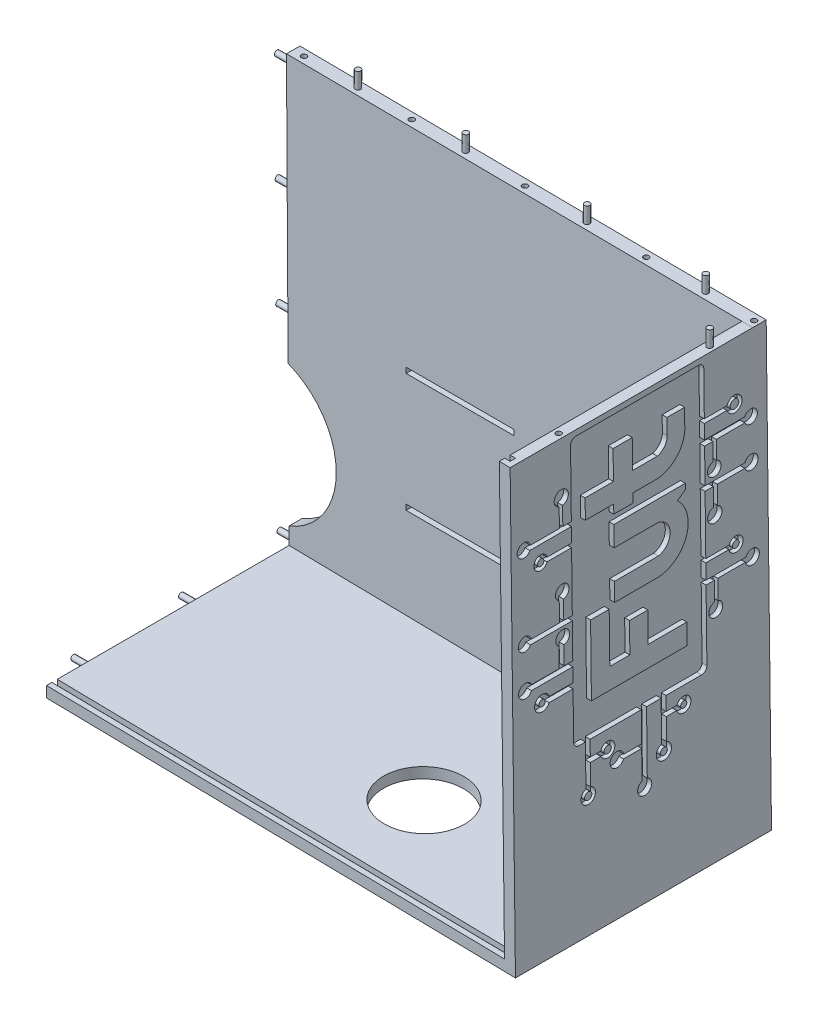
from build123d import *

# Parameters (mm, degrees)
SALIENTE_EXTRUIR1_DEPTH   = 2.5
SALIENTE_EXTRUIR2_DEPTH   = 45
CROQUIS17_R               = 1.5
CROQUIS17_R_2             = 2
CROQUIS17_W               = 20
CROQUIS17_H               = 1
CORTAR_EXTRUIR1_DEPTH     = 45
CORTAR_EXTRUIR2_REACH     = 131.472
CROQUIS18_W               = 1.000217957
CROQUIS18_H               = 1
CROQUIS19_W               = 1
CROQUIS19_H               = 79.48231635
CORTAR_EXTRUIR3_DEPTH     = 1
CROQUIS27_W               = 1
CROQUIS27_H               = 1
CORTAR_EXTRUIR7_DEPTH     = 1
CORTAR_EXTRUIR8_START     = -1
CORTAR_EXTRUIR8_OUTLINE_W = 85.327046857
CORTAR_EXTRUIR8_OUTLINE_H = 1
CORTAR_EXTRUIR8_DEPTH     = 1
CORTAR_EXTRUIR9_START     = 45.5
CORTAR_EXTRUIR9_DEPTH     = 0.999774645
CROQUIS30_R               = 0.5
CORTAR_EXTRUIR10_DEPTH    = 4
CROQUIS32_R               = 0.5
SALIENTE_EXTRUIR3_DEPTH   = 3
CROQUIS33_R               = 0.5
CORTAR_EXTRUIR14_DEPTH    = 4
CROQUIS34_R               = 0.5
SALIENTE_EXTRUIR4_DEPTH   = 3
CROQUIS35_R               = 0.5
SALIENTE_EXTRUIR5_DEPTH   = 3
CROQUIS36_R               = 0.5
CORTAR_EXTRUIR15_DEPTH    = 4
CROQUIS37_R               = 0.5
CORTAR_EXTRUIR16_DEPTH    = 4
CROQUIS38_R               = 0.5
SALIENTE_EXTRUIR6_DEPTH   = 3
CROQUIS39_R               = 7.5
CORTAR_EXTRUIR17_DEPTH    = 45
CROQUIS40_R               = 0.809361407
CROQUIS40_R_2             = 0.629854235
CROQUIS40_R_3             = 0.570829354
CROQUIS40_R_4             = 0.638132934
CROQUIS40_R_5             = 0.670441591
CROQUIS40_R_6             = 0.67413745
CROQUIS40_R_7             = 0.574661976
CROQUIS40_R_8             = 0.600575541
CORTAR_EXTRUIR18_DEPTH    = 0.9


# Read off the part's stored shape, not the designer's step: Cortar-Extruir8, Cortar-Extruir9
with BuildPart() as part:
    # Croquis15 → Saliente-Extruir1 (new body)
    with BuildSketch(Plane.XY):
        Polygon((0.493585448, -0.747010607), (86.987170897, -1.494021214), (87.974341793, -82.988042428), (0.987170897, -81.494021214), align=None)
    extrude(amount=SALIENTE_EXTRUIR1_DEPTH)

    # Croquis16 → Saliente-Extruir2 (add)
    with BuildSketch(Plane.XY.offset(2.5)):
        Polygon((0.974771701, -79.49351329), (0.987170897, -81.494021214), (87.974341793, -82.988042428), (86.987170897, -1.494021214), (84.986811751, -1.476485582), (85.949543401, -80.952971165), align=None)
    extrude(amount=SALIENTE_EXTRUIR2_DEPTH)

    # Croquis17 → Cortar-Extruir1 (cut)
    with BuildSketch(Plane.XY.offset(2.5)):
        with Locations((72.120400503, -26)):
            Circle(CROQUIS17_R)
        with Locations((80.899665143, -76.865648614)):
            Circle(CROQUIS17_R_2)
        with BuildLine():
            Line((0.955966786, -76.389254287), (0.796795552, -50.349991207))
            ThreePointArc((0.796795552, -50.349991207), (9.730065674, -63.315502479), (0.955966786, -76.389254287))
        make_face()
        with Locations((32.694186133, -62.5)):
            Rectangle(CROQUIS17_W, CROQUIS17_H)
        with Locations((62.694186133, -62.5)):
            Rectangle(CROQUIS17_W, CROQUIS17_H)
        with Locations((32.694186133, -40.5)):
            Rectangle(CROQUIS17_W, CROQUIS17_H)
        with Locations((62.694186133, -40.5)):
            Rectangle(CROQUIS17_W, CROQUIS17_H)
    extrude(amount=-CORTAR_EXTRUIR1_DEPTH, mode=Mode.SUBTRACT)

    # Cortar-Extruir2: up to this face of the body (flat: up to its plane)
    cortar_extruir2_end = Plane(part.part.faces().sort_by_distance((43.462157551, -80.223242227, 25))[0])
    # Croquis18 → Cortar-Extruir2 (cut, up to the picked face)
    with BuildSketch(Plane(origin=(-0.006411756, -0.731414451, 0), x_dir=(0.9999615787185102, -0.008765904789859459, 0), z_dir=(0.008765904789859457, 0.9999615787185101, 0)), mode=Mode.PRIVATE) as cortar_extruir2_sk1:
        with Locations((85.49659828, -46)):
            Rectangle(CROQUIS18_W, CROQUIS18_H)
    cortar_extruir2_tool1 = split(extrude(cortar_extruir2_sk1.sketch, amount=-CORTAR_EXTRUIR2_REACH, mode=Mode.PRIVATE), bisect_by=cortar_extruir2_end, keep=Keep.BOTH, mode=Mode.PRIVATE)
    add(cortar_extruir2_tool1.solids().sort_by(Axis((85.486902, -1.480869, 46), (-0.008765904789859457, -0.9999615787185101, 0)))[0], mode=Mode.SUBTRACT)

    # Croquis19 → Cortar-Extruir3 (cut)
    with BuildSketch(Plane(origin=(84.956460397, 1.029112859, 0), x_dir=(0, 0, 1), z_dir=(-0.9999266406620362, -0.012112526339916574, 0))):
        with Locations((46, -42.246940442)):
            Rectangle(CROQUIS19_W, CROQUIS19_H)
    extrude(amount=-CORTAR_EXTRUIR3_DEPTH, mode=Mode.SUBTRACT)

    # Croquis27 → Cortar-Extruir7 (cut)
    with BuildSketch(Plane(origin=(0.993083004, -81.982084024, 0), x_dir=(0.9999266406620362, 0.012112526339916574, 0), z_dir=(-0.012112526339916574, 0.9999266406620362, 0))):
        with Locations((85.462693204, -46)):
            Rectangle(CROQUIS27_W, CROQUIS27_H)
    extrude(amount=-CORTAR_EXTRUIR7_DEPTH, mode=Mode.SUBTRACT)

    # Cortar-Extruir8 outline → Cortar-Extruir8 (cut)
    with BuildSketch(Plane(origin=(-1.364626126, -79.453333687, 0), x_dir=(0.9998525390425657, -0.01717265763167723, 0), z_dir=(0.01717265763167723, 0.9998525390425657, 0)).offset(CORTAR_EXTRUIR8_START)):
        with Locations((44.663523428, -46)):
            Rectangle(CORTAR_EXTRUIR8_OUTLINE_W, CORTAR_EXTRUIR8_OUTLINE_H)
    extrude(amount=CORTAR_EXTRUIR8_DEPTH, mode=Mode.SUBTRACT)

    # Cortar-Extruir9 outline → Cortar-Extruir9 (cut)
    with BuildSketch(Plane.XY.offset(CORTAR_EXTRUIR9_START)):
        Polygon((85.961655928, -81.952897805), (85.949543401, -80.952971165), (85.932370744, -81.952823704), (86.961942597, -81.970506796), (86.961582568, -81.940785279), align=None)
    extrude(amount=CORTAR_EXTRUIR9_DEPTH, mode=Mode.SUBTRACT)

    # Croquis30 → Cortar-Extruir10 (cut)
    with BuildSketch(Plane(origin=(-0.006411756, -0.731414451, 0), x_dir=(0.9999615787185102, -0.008765904789859459, 0), z_dir=(0.008765904789859457, 0.9999615787185101, 0))):
        with Locations(Location((85.996707183, -37.5, 0), (0, 0, 180))):
            Circle(CROQUIS30_R)
    extrude(amount=-CORTAR_EXTRUIR10_DEPTH, mode=Mode.SUBTRACT)

    # Croquis32 → Saliente-Extruir3 (add)
    with BuildSketch(Plane(origin=(-0.006414337, -0.742692308, 0), x_dir=(0.9999627066458414, -0.008636279148040221, 0), z_dir=(0.008636279148040221, 0.9999627066458414, 0))):
        with Locations((12.500018433, -1.25)):
            Circle(CROQUIS32_R)
        with Locations((32.500018433, -1.25)):
            Circle(CROQUIS32_R)
        with Locations((55.000018433, -1.25)):
            Circle(CROQUIS32_R)
        with Locations((77.000018433, -1.25)):
            Circle(CROQUIS32_R)
    extrude(amount=SALIENTE_EXTRUIR3_DEPTH)

    # Croquis33 → Cortar-Extruir14 (cut)
    with BuildSketch(Plane(origin=(-0.006414337, -0.742692308, 0), x_dir=(0.9999627066458414, -0.008636279148040221, 0), z_dir=(0.008636279148040221, 0.9999627066458414, 0))):
        with Locations(Location((85.996829638, -1.25, 0), (0, 0, 180))):
            Circle(CROQUIS33_R)
        with Locations(Location((2.500018433, -1.25, 0), (0, 0, 180))):
            Circle(CROQUIS33_R)
        with Locations(Location((22.500018433, -1.25, 0), (0, 0, 180))):
            Circle(CROQUIS33_R)
        with Locations(Location((43.496829638, -1.25, 0), (0, 0, 180))):
            Circle(CROQUIS33_R)
        with Locations(Location((65.996829638, -1.25, 0), (0, 0, 180))):
            Circle(CROQUIS33_R)
    extrude(amount=-CORTAR_EXTRUIR14_DEPTH, mode=Mode.SUBTRACT)

    # Croquis34 → Saliente-Extruir4 (add)
    with BuildSketch(Plane(origin=(-0.006411756, -0.731414451, 0), x_dir=(0.9999615787185102, -0.008765904789859459, 0), z_dir=(0.008765904789859457, 0.9999615787185101, 0))):
        with Locations((85.996707183, -9.5)):
            Circle(CROQUIS34_R)
    extrude(amount=SALIENTE_EXTRUIR4_DEPTH)

    # Croquis35 → Saliente-Extruir5 (add)
    with BuildSketch(Plane(origin=(0.489000895, 0.002989135, 0), x_dir=(0, 0, 1), z_dir=(-0.9999813177309185, -0.006112625388175005, 0))):
        with Locations(Location((1.25, -79.193670629, 0), (0, 0, 90))):
            Circle(CROQUIS35_R)
        with Locations(Location((1.25, -2.750013754, 0), (0, 0, 90))):
            Circle(CROQUIS35_R)
        with Locations(Location((1.25, -22.750013754, 0), (0, 0, 90))):
            Circle(CROQUIS35_R)
        with Locations(Location((1.25, -42.750013754, 0), (0, 0, 90))):
            Circle(CROQUIS35_R)
    extrude(amount=SALIENTE_EXTRUIR5_DEPTH)

    # Croquis36 → Cortar-Extruir15 (cut)
    with BuildSketch(Plane(origin=(0.489000895, 0.002989135, 0), x_dir=(0, 0, 1), z_dir=(-0.9999813177309185, -0.006112625388175005, 0))):
        with Locations(Location((1.25, -12.750013754, 0), (0, 0, 270))):
            Circle(CROQUIS36_R)
        with Locations(Location((1.25, -32.750013754, 0), (0, 0, 270))):
            Circle(CROQUIS36_R)
    extrude(amount=-CORTAR_EXTRUIR15_DEPTH, mode=Mode.SUBTRACT)

    # Croquis37 → Cortar-Extruir16 (cut)
    with BuildSketch(Plane(origin=(0.482050481, 0.00298776, 0), x_dir=(0, 0, 1), z_dir=(-0.9999807928027947, -0.006197904927802061, 0))):
        with Locations(Location((9.5, -80.498301159, 0), (0, 0, 270))):
            Circle(CROQUIS37_R)
        with Locations(Location((29.5, -80.498301159, 0), (0, 0, 270))):
            Circle(CROQUIS37_R)
    extrude(amount=-CORTAR_EXTRUIR16_DEPTH, mode=Mode.SUBTRACT)

    # Croquis38 → Saliente-Extruir6 (add)
    with BuildSketch(Plane(origin=(0.482050481, 0.00298776, 0), x_dir=(0, 0, 1), z_dir=(-0.9999807928027947, -0.006197904927802061, 0))):
        with Locations(Location((19.5, -80.498301159, 0), (0, 0, 90))):
            Circle(CROQUIS38_R)
        with Locations(Location((39.5, -80.498301159, 0), (0, 0, 90))):
            Circle(CROQUIS38_R)
    extrude(amount=SALIENTE_EXTRUIR6_DEPTH)

    # Croquis39 → Cortar-Extruir17 (cut)
    with BuildSketch(Plane(origin=(-1.398971441, -81.453038765, 0), x_dir=(0.9998525390425657, -0.017172657631677572, 0), z_dir=(-0.017172657631677572, -0.9998525390425657, 0))):
        with Locations((54.886494253, 30)):
            Circle(CROQUIS39_R)
    extrude(amount=-CORTAR_EXTRUIR17_DEPTH, mode=Mode.SUBTRACT)

    # Croquis40 → Cortar-Extruir18 (cut)
    with BuildSketch(Plane(origin=(86.956313679, 1.053337912, 0), x_dir=(0, 0, -1), z_dir=(0.9999266406620362, 0.012112526339916486, 0))):
        with BuildLine():
            Line((-35.321453593, -52.987764763), (-34.142461856, -52.987764763))
            Line((-34.142461856, -52.987764763), (-34.142461856, -60.542839641))
            ThreePointArc((-34.142461856, -60.542839641), (-33.754916637, -63.170516444), (-33.276623684, -60.557833431))
            Line((-33.276623684, -60.557833431), (-33.276623684, -56.702399451))
            Line((-33.276623684, -56.702399451), (-31.334219947, -56.702399451))
            Line((-31.334219947, -56.702399451), (-31.334219947, -56.632292597))
            ThreePointArc((-31.334219947, -56.632292597), (-28.717421131, -56.230691353), (-31.334219947, -55.829090109))
            Line((-31.334219947, -55.829090109), (-33.276623684, -55.829090109))
            Line((-33.276623684, -55.829090109), (-33.276623684, -52.987764763))
            Line((-33.276623684, -52.987764763), (-23.78409883, -52.987764763))
            Line((-23.78409883, -52.987764763), (-23.78409883, -58.451870369))
            Line((-23.78409883, -58.451870369), (-27.078464782, -58.451870369))
            ThreePointArc((-27.078464782, -58.451870369), (-29.642810051, -58.571842219), (-27.147404615, -59.174512621))
            Line((-27.147404615, -59.174512621), (-23.78409883, -59.174512621))
            Line((-23.78409883, -59.174512621), (-23.78409883, -64.379197107))
            ThreePointArc((-23.78409883, -64.379197107), (-23.307020575, -66.916868312), (-22.806237845, -64.383768341))
            Line((-22.806237845, -64.383768341), (-22.806237845, -52.987764763))
            Line((-22.806237845, -52.987764763), (-20.10704587, -52.987764763))
            Line((-20.10704587, -52.987764763), (-20.10704587, -60.316709651))
            ThreePointArc((-20.10704587, -60.316709651), (-19.748308907, -63.096133993), (-19.177814951, -60.3523358))
            Line((-19.177814951, -60.3523358), (-19.177814951, -56.37998398))
            Line((-19.177814951, -56.37998398), (-17.24921123, -56.37998398))
            ThreePointArc((-17.24921123, -56.37998398), (-14.598976542, -56.129487104), (-17.196256272, -55.54585144))
            Line((-17.196256272, -55.54585144), (-19.177814951, -55.54585144))
            Line((-19.177814951, -55.54585144), (-19.177814951, -52.987764763))
            Line((-19.177814951, -52.987764763), (-12.598993017, -52.987764763))
            ThreePointArc((-12.598993017, -52.987764763), (-11.891886235, -52.694871544), (-11.598993017, -51.987764763))
            Line((-11.598993017, -51.987764763), (-11.598993017, -39.13545201))
            Line((-11.598993017, -39.13545201), (-10.068321238, -39.13545201))
            Line((-10.068321238, -39.13545201), (-10.068321238, -42.601545003))
            ThreePointArc((-10.068321238, -42.601545003), (-9.968781236, -45.173633), (-9.430157863, -42.656605043))
            Line((-9.430157863, -42.656605043), (-9.430157863, -39.13545201))
            Line((-9.430157863, -39.13545201), (-4.301299872, -39.13545201))
            ThreePointArc((-4.301299872, -39.13545201), (-1.711529233, -39.011167494), (-4.222977752, -38.366974247))
            Line((-4.222977752, -38.366974247), (-11.598993017, -38.366974247))
            Line((-11.598993017, -38.366974247), (-11.598993017, -35.594319451))
            Line((-11.598993017, -35.594319451), (-7.323827615, -35.594319451))
            ThreePointArc((-7.323827615, -35.594319451), (-4.689856854, -35.477661267), (-7.266707092, -34.919759885))
            Line((-7.266707092, -34.919759885), (-11.598993017, -34.919759885))
            Line((-11.598993017, -34.919759885), (-11.598993017, -24.159994807))
            Line((-11.598993017, -24.159994807), (-10.068321238, -24.159994807))
            Line((-10.068321238, -24.159994807), (-10.068321238, -27.456141429))
            ThreePointArc((-10.068321238, -27.456141429), (-10.019683396, -30.106586357), (-9.334093639, -27.545885156))
            Line((-9.334093639, -27.545885156), (-9.334093639, -24.159994807))
            Line((-9.334093639, -24.159994807), (-4.221836015, -24.159994807))
            ThreePointArc((-4.221836015, -24.159994807), (-1.744452595, -23.78763641), (-4.200799915, -23.295257261))
            Line((-4.200799915, -23.295257261), (-11.598993017, -23.295257261))
            Line((-11.598993017, -23.295257261), (-11.598993017, -16.951251608))
            Line((-11.598993017, -16.951251608), (-10.068321238, -16.951251608))
            Line((-10.068321238, -16.951251608), (-10.068321238, -20.216753978))
            ThreePointArc((-10.068321238, -20.216753978), (-9.968995906, -22.715299337), (-9.430157863, -20.27352785))
            Line((-9.430157863, -20.27352785), (-9.430157863, -16.951251608))
            Line((-9.430157863, -16.951251608), (-4.135707555, -16.951251608))
            ThreePointArc((-4.135707555, -16.951251608), (-1.79806732, -16.485853325), (-4.125355235, -15.971180233))
            Line((-4.125355235, -15.971180233), (-11.598993017, -15.971180233))
            Line((-11.598993017, -15.971180233), (-11.598993017, -13.333436265))
            Line((-11.598993017, -13.333436265), (-7.391177938, -13.333436265))
            ThreePointArc((-7.391177938, -13.333436265), (-4.59909362, -13.043688074), (-7.36991632, -12.593987708))
            Line((-7.36991632, -12.593987708), (-11.598993017, -12.593987708))
            Line((-11.598993017, -12.593987708), (-11.598993017, -4.565500521))
            ThreePointArc((-11.598993017, -4.565500521), (-11.891886235, -3.85839374), (-12.598993017, -3.565500521))
            Line((-12.598993017, -3.565500521), (-35.321453593, -3.565500521))
            ThreePointArc((-35.321453593, -3.565500521), (-36.028560375, -3.85839374), (-36.321453593, -4.565500521))
            Line((-36.321453593, -4.565500521), (-36.321453593, -16.717569406))
            Line((-36.321453593, -16.717569406), (-37.903967701, -16.717569406))
            Line((-37.903967701, -16.717569406), (-37.903967701, -13.333436265))
            ThreePointArc((-37.903967701, -13.333436265), (-38.034196896, -10.722455801), (-38.538139606, -13.287649824))
            Line((-38.538139606, -13.287649824), (-38.538139606, -16.717569406))
            Line((-38.538139606, -16.717569406), (-43.914043961, -16.717569406))
            ThreePointArc((-43.914043961, -16.717569406), (-46.357964621, -16.785517438), (-44.019570798, -17.499155623))
            Line((-44.019570798, -17.499155623), (-36.321453593, -17.499155623))
            Line((-36.321453593, -17.499155623), (-36.321453593, -20.144536407))
            Line((-36.321453593, -20.144536407), (-40.826873033, -20.144536407))
            ThreePointArc((-40.826873033, -20.144536407), (-43.309432582, -20.356483396), (-40.873506552, -20.880208343))
            Line((-40.873506552, -20.880208343), (-36.321453593, -20.880208343))
            Line((-36.321453593, -20.880208343), (-36.321453593, -31.72037316))
            Line((-36.321453593, -31.72037316), (-37.903967701, -31.72037316))
            Line((-37.903967701, -31.72037316), (-37.903967701, -28.287938167))
            ThreePointArc((-37.903967701, -28.287938167), (-37.944179352, -25.795120339), (-38.704318145, -28.169556423))
            Line((-38.704318145, -28.169556423), (-38.704318145, -31.72037316))
            Line((-38.704318145, -31.72037316), (-43.926556603, -31.72037316))
            ThreePointArc((-43.926556603, -31.72037316), (-46.335462188, -31.726652991), (-44.07166852, -32.550123562))
            Line((-44.07166852, -32.550123562), (-36.321453593, -32.550123562))
            Line((-36.321453593, -32.550123562), (-36.321453593, -38.950401985))
            Line((-36.321453593, -38.950401985), (-37.903967701, -38.950401985))
            Line((-37.903967701, -38.950401985), (-37.903967701, -35.594319451))
            ThreePointArc((-37.903967701, -35.594319451), (-37.873303697, -33.075646288), (-38.829573598, -35.405925812))
            Line((-38.829573598, -35.405925812), (-38.829573598, -38.950401985))
            Line((-38.829573598, -38.950401985), (-43.967821846, -38.950401985))
            ThreePointArc((-43.967821846, -38.950401985), (-46.379716181, -39.393105012), (-43.978862957, -39.892228293))
            Line((-43.978862957, -39.892228293), (-36.321453593, -39.892228293))
            Line((-36.321453593, -39.892228293), (-36.321453593, -42.450354157))
            Line((-36.321453593, -42.450354157), (-40.715071222, -42.450354157))
            ThreePointArc((-40.715071222, -42.450354157), (-43.449505089, -42.782825657), (-40.771245208, -43.426712201))
            Line((-40.771245208, -43.426712201), (-36.321453593, -43.426712201))
            Line((-36.321453593, -43.426712201), (-36.321453593, -51.987764763))
            ThreePointArc((-36.321453593, -51.987764763), (-36.028560375, -52.694871544), (-35.321453593, -52.987764763))
        make_face()
        with Locations(Location((-6.014393146, -13.002993481, 0), (0, 0, 90))):
            Circle(CROQUIS40_R, mode=Mode.SUBTRACT)
        with Locations(Location((-6.014393146, -35.365501853, 0), (0, 0, 90))):
            Circle(CROQUIS40_R_2, mode=Mode.SUBTRACT)
        with Locations(Location((-15.944003083, -56.044098008, 0), (0, 0, 90))):
            Circle(CROQUIS40_R_3, mode=Mode.SUBTRACT)
        with Locations(Location((-19.693871216, -61.67624474, 0), (0, 0, 90))):
            Circle(CROQUIS40_R_4, mode=Mode.SUBTRACT)
        with Locations(Location((-30.056637497, -56.230691353, 0), (0, 0, 90))):
            Circle(CROQUIS40_R_5, mode=Mode.SUBTRACT)
        with Locations(Location((-33.731610366, -61.824661974, 0), (0, 0, 90))):
            Circle(CROQUIS40_R_6, mode=Mode.SUBTRACT)
        with Locations(Location((-42.052302049, -42.863212626, 0), (0, 0, 90))):
            Circle(CROQUIS40_R_7, mode=Mode.SUBTRACT)
        with Locations(Location((-42.052302049, -20.436171663, 0), (0, 0, 90))):
            Circle(CROQUIS40_R_8, mode=Mode.SUBTRACT)
        Polygon((-29.506270658, -34.090973296), (-32.95979632, -34.090973296), (-32.95979632, -47.023436843), (-15.219740617, -47.023436843), (-15.219740617, -43.241444599), (-22.384112716, -43.241444599), (-22.384112716, -37.745680985), (-25.782301237, -37.745680985), (-25.782301237, -43.241444599), (-29.506270658, -43.241444599), align=None, mode=Mode.SUBTRACT)
        with BuildLine():
            Line((-28.477288339, -33.516957409), (-28.477288339, -30.157522298))
            Line((-28.477288339, -30.157522298), (-20.322738834, -30.157522298))
            ThreePointArc((-20.322738834, -30.157522298), (-18.116682497, -27.483193604), (-20.322738834, -24.808864909))
            Line((-20.322738834, -24.808864909), (-28.477288339, -24.808864909))
            Line((-28.477288339, -24.808864909), (-28.477288339, -21.077207061))
            Line((-28.477288339, -21.077207061), (-15.219740617, -21.077207061))
            Line((-15.219740617, -21.077207061), (-15.219740617, -22.107647648))
            Line((-15.219740617, -22.107647648), (-16.719853741, -23.114379869))
            ThreePointArc((-16.719853741, -23.114379869), (-15.271960601, -29.921137092), (-21.230015207, -33.516957409))
            Line((-21.230015207, -33.516957409), (-28.113279076, -33.516957409))
            Line((-28.113279076, -33.516957409), (-28.477288339, -33.516957409))
        make_face(mode=Mode.SUBTRACT)
        with BuildLine():
            Line((-28.477288339, -14.216760184), (-33.731610366, -14.216760184))
            Line((-33.731610366, -14.216760184), (-33.731610366, -17.797025195))
            Line((-33.731610366, -17.797025195), (-28.477288339, -17.797025195))
            Line((-28.477288339, -17.797025195), (-28.477288339, -19.428021447))
            Line((-28.477288339, -19.428021447), (-24.928470983, -19.428021447))
            Line((-24.928470983, -19.428021447), (-24.928470983, -17.797025195))
            Line((-24.928470983, -17.797025195), (-20.322738834, -17.797025195))
            ThreePointArc((-20.322738834, -17.797025195), (-16.815008068, -16.133352556), (-15.219740617, -12.593987708))
            Line((-15.219740617, -12.593987708), (-15.219740617, -8.945920879))
            Line((-15.219740617, -8.945920879), (-18.477212796, -8.945920879))
            Line((-18.477212796, -8.945920879), (-18.477212796, -11.861562453))
            ThreePointArc((-18.477212796, -11.861562453), (-19.003697036, -13.349684209), (-20.322738834, -14.216760184))
            Line((-20.322738834, -14.216760184), (-24.928470983, -14.216760184))
            Line((-24.928470983, -14.216760184), (-24.928470983, -8.945920879))
            Line((-24.928470983, -8.945920879), (-28.477288339, -8.945920879))
            Line((-28.477288339, -8.945920879), (-28.477288339, -14.216760184))
        make_face(mode=Mode.SUBTRACT)
    extrude(amount=-CORTAR_EXTRUIR18_DEPTH, mode=Mode.SUBTRACT)


solid = part.part
